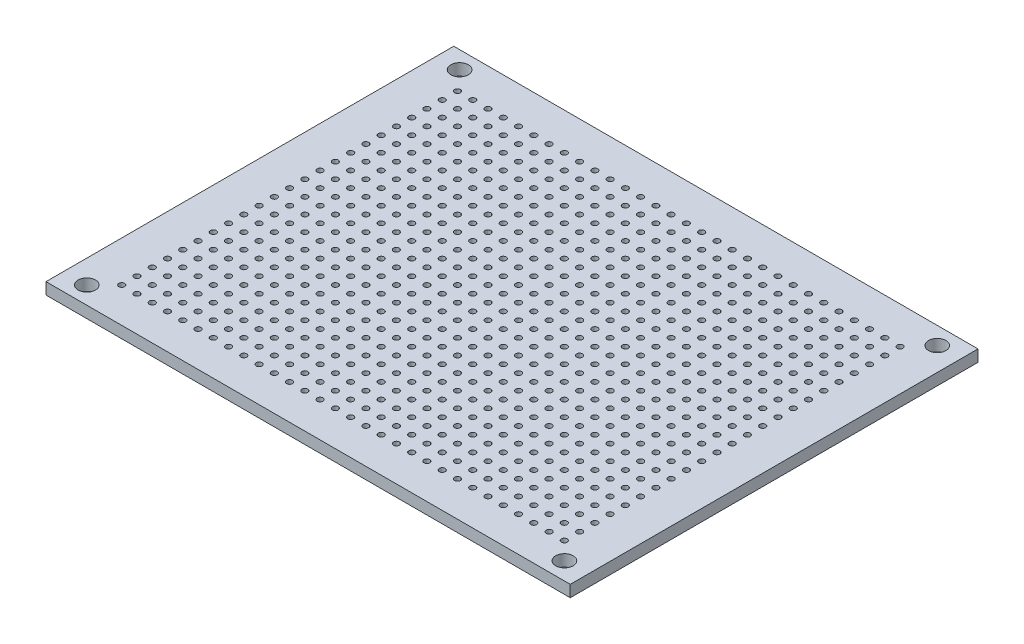
from build123d import *

# Parameters (mm, degrees)
SKETCH1_W           = 90
SKETCH1_H           = 70
SKETCH1_R           = 1.5
SKETCH1_R_2         = 0.5
BOSS_EXTRUDE1_DEPTH = 2


with BuildPart() as part:
    # Sketch1 → Boss-Extrude1 (new body)
    with BuildSketch(Plane(origin=(0, 0, 0), x_dir=(1, 0, 0), z_dir=(0, 1, 0))):
        Rectangle(SKETCH1_W, SKETCH1_H)
        with Locations((-41, -32)):
            Circle(SKETCH1_R, mode=Mode.SUBTRACT)
        with Locations((-38, -29)):
            Circle(SKETCH1_R_2, mode=Mode.SUBTRACT)
        with Locations((-35.38, -29)):
            Circle(SKETCH1_R_2, mode=Mode.SUBTRACT)
        with Locations((-32.76, -29)):
            Circle(SKETCH1_R_2, mode=Mode.SUBTRACT)
        with Locations((-30.14, -29)):
            Circle(SKETCH1_R_2, mode=Mode.SUBTRACT)
        with Locations((-27.52, -29)):
            Circle(SKETCH1_R_2, mode=Mode.SUBTRACT)
        with Locations((-24.9, -29)):
            Circle(SKETCH1_R_2, mode=Mode.SUBTRACT)
        with Locations((-22.28, -29)):
            Circle(SKETCH1_R_2, mode=Mode.SUBTRACT)
        with Locations((-19.66, -29)):
            Circle(SKETCH1_R_2, mode=Mode.SUBTRACT)
        with Locations((-17.04, -29)):
            Circle(SKETCH1_R_2, mode=Mode.SUBTRACT)
        with Locations((-14.42, -29)):
            Circle(SKETCH1_R_2, mode=Mode.SUBTRACT)
        with Locations((-11.8, -29)):
            Circle(SKETCH1_R_2, mode=Mode.SUBTRACT)
        with Locations((-9.18, -29)):
            Circle(SKETCH1_R_2, mode=Mode.SUBTRACT)
        with Locations((-6.56, -29)):
            Circle(SKETCH1_R_2, mode=Mode.SUBTRACT)
        with Locations((-3.94, -29)):
            Circle(SKETCH1_R_2, mode=Mode.SUBTRACT)
        with Locations((-1.32, -29)):
            Circle(SKETCH1_R_2, mode=Mode.SUBTRACT)
        with Locations((1.3, -29)):
            Circle(SKETCH1_R_2, mode=Mode.SUBTRACT)
        with Locations((3.92, -29)):
            Circle(SKETCH1_R_2, mode=Mode.SUBTRACT)
        with Locations((6.54, -29)):
            Circle(SKETCH1_R_2, mode=Mode.SUBTRACT)
        with Locations((9.16, -29)):
            Circle(SKETCH1_R_2, mode=Mode.SUBTRACT)
        with Locations((11.78, -29)):
            Circle(SKETCH1_R_2, mode=Mode.SUBTRACT)
        with Locations((14.4, -29)):
            Circle(SKETCH1_R_2, mode=Mode.SUBTRACT)
        with Locations((17.02, -29)):
            Circle(SKETCH1_R_2, mode=Mode.SUBTRACT)
        with Locations((19.64, -29)):
            Circle(SKETCH1_R_2, mode=Mode.SUBTRACT)
        with Locations((22.26, -29)):
            Circle(SKETCH1_R_2, mode=Mode.SUBTRACT)
        with Locations((24.88, -29)):
            Circle(SKETCH1_R_2, mode=Mode.SUBTRACT)
        with Locations((27.5, -29)):
            Circle(SKETCH1_R_2, mode=Mode.SUBTRACT)
        with Locations((30.12, -29)):
            Circle(SKETCH1_R_2, mode=Mode.SUBTRACT)
        with Locations((32.74, -29)):
            Circle(SKETCH1_R_2, mode=Mode.SUBTRACT)
        with Locations((35.36, -29)):
            Circle(SKETCH1_R_2, mode=Mode.SUBTRACT)
        with Locations((37.98, -29)):
            Circle(SKETCH1_R_2, mode=Mode.SUBTRACT)
        with Locations((-38, -26.38)):
            Circle(SKETCH1_R_2, mode=Mode.SUBTRACT)
        with Locations((-35.38, -26.38)):
            Circle(SKETCH1_R_2, mode=Mode.SUBTRACT)
        with Locations((-32.76, -26.38)):
            Circle(SKETCH1_R_2, mode=Mode.SUBTRACT)
        with Locations((-30.14, -26.38)):
            Circle(SKETCH1_R_2, mode=Mode.SUBTRACT)
        with Locations((-27.52, -26.38)):
            Circle(SKETCH1_R_2, mode=Mode.SUBTRACT)
        with Locations((-24.9, -26.38)):
            Circle(SKETCH1_R_2, mode=Mode.SUBTRACT)
        with Locations((-22.28, -26.38)):
            Circle(SKETCH1_R_2, mode=Mode.SUBTRACT)
        with Locations((-19.66, -26.38)):
            Circle(SKETCH1_R_2, mode=Mode.SUBTRACT)
        with Locations((-17.04, -26.38)):
            Circle(SKETCH1_R_2, mode=Mode.SUBTRACT)
        with Locations((-14.42, -26.38)):
            Circle(SKETCH1_R_2, mode=Mode.SUBTRACT)
        with Locations((-11.8, -26.38)):
            Circle(SKETCH1_R_2, mode=Mode.SUBTRACT)
        with Locations((-9.18, -26.38)):
            Circle(SKETCH1_R_2, mode=Mode.SUBTRACT)
        with Locations((-6.56, -26.38)):
            Circle(SKETCH1_R_2, mode=Mode.SUBTRACT)
        with Locations((-3.94, -26.38)):
            Circle(SKETCH1_R_2, mode=Mode.SUBTRACT)
        with Locations((-1.32, -26.38)):
            Circle(SKETCH1_R_2, mode=Mode.SUBTRACT)
        with Locations((1.3, -26.38)):
            Circle(SKETCH1_R_2, mode=Mode.SUBTRACT)
        with Locations((3.92, -26.38)):
            Circle(SKETCH1_R_2, mode=Mode.SUBTRACT)
        with Locations((6.54, -26.38)):
            Circle(SKETCH1_R_2, mode=Mode.SUBTRACT)
        with Locations((9.16, -26.38)):
            Circle(SKETCH1_R_2, mode=Mode.SUBTRACT)
        with Locations((11.78, -26.38)):
            Circle(SKETCH1_R_2, mode=Mode.SUBTRACT)
        with Locations((14.4, -26.38)):
            Circle(SKETCH1_R_2, mode=Mode.SUBTRACT)
        with Locations((17.02, -26.38)):
            Circle(SKETCH1_R_2, mode=Mode.SUBTRACT)
        with Locations((19.64, -26.38)):
            Circle(SKETCH1_R_2, mode=Mode.SUBTRACT)
        with Locations((22.26, -26.38)):
            Circle(SKETCH1_R_2, mode=Mode.SUBTRACT)
        with Locations((24.88, -26.38)):
            Circle(SKETCH1_R_2, mode=Mode.SUBTRACT)
        with Locations((27.5, -26.38)):
            Circle(SKETCH1_R_2, mode=Mode.SUBTRACT)
        with Locations((30.12, -26.38)):
            Circle(SKETCH1_R_2, mode=Mode.SUBTRACT)
        with Locations((32.74, -26.38)):
            Circle(SKETCH1_R_2, mode=Mode.SUBTRACT)
        with Locations((35.36, -26.38)):
            Circle(SKETCH1_R_2, mode=Mode.SUBTRACT)
        with Locations((37.98, -26.38)):
            Circle(SKETCH1_R_2, mode=Mode.SUBTRACT)
        with Locations((-38, -23.76)):
            Circle(SKETCH1_R_2, mode=Mode.SUBTRACT)
        with Locations((-35.38, -23.76)):
            Circle(SKETCH1_R_2, mode=Mode.SUBTRACT)
        with Locations((-32.76, -23.76)):
            Circle(SKETCH1_R_2, mode=Mode.SUBTRACT)
        with Locations((-30.14, -23.76)):
            Circle(SKETCH1_R_2, mode=Mode.SUBTRACT)
        with Locations((-27.52, -23.76)):
            Circle(SKETCH1_R_2, mode=Mode.SUBTRACT)
        with Locations((-24.9, -23.76)):
            Circle(SKETCH1_R_2, mode=Mode.SUBTRACT)
        with Locations((-22.28, -23.76)):
            Circle(SKETCH1_R_2, mode=Mode.SUBTRACT)
        with Locations((-19.66, -23.76)):
            Circle(SKETCH1_R_2, mode=Mode.SUBTRACT)
        with Locations((-17.04, -23.76)):
            Circle(SKETCH1_R_2, mode=Mode.SUBTRACT)
        with Locations((-14.42, -23.76)):
            Circle(SKETCH1_R_2, mode=Mode.SUBTRACT)
        with Locations((-11.8, -23.76)):
            Circle(SKETCH1_R_2, mode=Mode.SUBTRACT)
        with Locations((-9.18, -23.76)):
            Circle(SKETCH1_R_2, mode=Mode.SUBTRACT)
        with Locations((-6.56, -23.76)):
            Circle(SKETCH1_R_2, mode=Mode.SUBTRACT)
        with Locations((-3.94, -23.76)):
            Circle(SKETCH1_R_2, mode=Mode.SUBTRACT)
        with Locations((-1.32, -23.76)):
            Circle(SKETCH1_R_2, mode=Mode.SUBTRACT)
        with Locations((1.3, -23.76)):
            Circle(SKETCH1_R_2, mode=Mode.SUBTRACT)
        with Locations((3.92, -23.76)):
            Circle(SKETCH1_R_2, mode=Mode.SUBTRACT)
        with Locations((6.54, -23.76)):
            Circle(SKETCH1_R_2, mode=Mode.SUBTRACT)
        with Locations((9.16, -23.76)):
            Circle(SKETCH1_R_2, mode=Mode.SUBTRACT)
        with Locations((11.78, -23.76)):
            Circle(SKETCH1_R_2, mode=Mode.SUBTRACT)
        with Locations((14.4, -23.76)):
            Circle(SKETCH1_R_2, mode=Mode.SUBTRACT)
        with Locations((17.02, -23.76)):
            Circle(SKETCH1_R_2, mode=Mode.SUBTRACT)
        with Locations((19.64, -23.76)):
            Circle(SKETCH1_R_2, mode=Mode.SUBTRACT)
        with Locations((22.26, -23.76)):
            Circle(SKETCH1_R_2, mode=Mode.SUBTRACT)
        with Locations((24.88, -23.76)):
            Circle(SKETCH1_R_2, mode=Mode.SUBTRACT)
        with Locations((27.5, -23.76)):
            Circle(SKETCH1_R_2, mode=Mode.SUBTRACT)
        with Locations((30.12, -23.76)):
            Circle(SKETCH1_R_2, mode=Mode.SUBTRACT)
        with Locations((32.74, -23.76)):
            Circle(SKETCH1_R_2, mode=Mode.SUBTRACT)
        with Locations((35.36, -23.76)):
            Circle(SKETCH1_R_2, mode=Mode.SUBTRACT)
        with Locations((37.98, -23.76)):
            Circle(SKETCH1_R_2, mode=Mode.SUBTRACT)
        with Locations((-38, -21.14)):
            Circle(SKETCH1_R_2, mode=Mode.SUBTRACT)
        with Locations((-35.38, -21.14)):
            Circle(SKETCH1_R_2, mode=Mode.SUBTRACT)
        with Locations((-32.76, -21.14)):
            Circle(SKETCH1_R_2, mode=Mode.SUBTRACT)
        with Locations((-30.14, -21.14)):
            Circle(SKETCH1_R_2, mode=Mode.SUBTRACT)
        with Locations((-27.52, -21.14)):
            Circle(SKETCH1_R_2, mode=Mode.SUBTRACT)
        with Locations((-24.9, -21.14)):
            Circle(SKETCH1_R_2, mode=Mode.SUBTRACT)
        with Locations((-22.28, -21.14)):
            Circle(SKETCH1_R_2, mode=Mode.SUBTRACT)
        with Locations((-19.66, -21.14)):
            Circle(SKETCH1_R_2, mode=Mode.SUBTRACT)
        with Locations((-17.04, -21.14)):
            Circle(SKETCH1_R_2, mode=Mode.SUBTRACT)
        with Locations((-14.42, -21.14)):
            Circle(SKETCH1_R_2, mode=Mode.SUBTRACT)
        with Locations((-11.8, -21.14)):
            Circle(SKETCH1_R_2, mode=Mode.SUBTRACT)
        with Locations((-9.18, -21.14)):
            Circle(SKETCH1_R_2, mode=Mode.SUBTRACT)
        with Locations((-6.56, -21.14)):
            Circle(SKETCH1_R_2, mode=Mode.SUBTRACT)
        with Locations((-3.94, -21.14)):
            Circle(SKETCH1_R_2, mode=Mode.SUBTRACT)
        with Locations((-1.32, -21.14)):
            Circle(SKETCH1_R_2, mode=Mode.SUBTRACT)
        with Locations((1.3, -21.14)):
            Circle(SKETCH1_R_2, mode=Mode.SUBTRACT)
        with Locations((3.92, -21.14)):
            Circle(SKETCH1_R_2, mode=Mode.SUBTRACT)
        with Locations((6.54, -21.14)):
            Circle(SKETCH1_R_2, mode=Mode.SUBTRACT)
        with Locations((9.16, -21.14)):
            Circle(SKETCH1_R_2, mode=Mode.SUBTRACT)
        with Locations((11.78, -21.14)):
            Circle(SKETCH1_R_2, mode=Mode.SUBTRACT)
        with Locations((14.4, -21.14)):
            Circle(SKETCH1_R_2, mode=Mode.SUBTRACT)
        with Locations((17.02, -21.14)):
            Circle(SKETCH1_R_2, mode=Mode.SUBTRACT)
        with Locations((19.64, -21.14)):
            Circle(SKETCH1_R_2, mode=Mode.SUBTRACT)
        with Locations((22.26, -21.14)):
            Circle(SKETCH1_R_2, mode=Mode.SUBTRACT)
        with Locations((24.88, -21.14)):
            Circle(SKETCH1_R_2, mode=Mode.SUBTRACT)
        with Locations((27.5, -21.14)):
            Circle(SKETCH1_R_2, mode=Mode.SUBTRACT)
        with Locations((30.12, -21.14)):
            Circle(SKETCH1_R_2, mode=Mode.SUBTRACT)
        with Locations((32.74, -21.14)):
            Circle(SKETCH1_R_2, mode=Mode.SUBTRACT)
        with Locations((35.36, -21.14)):
            Circle(SKETCH1_R_2, mode=Mode.SUBTRACT)
        with Locations((37.98, -21.14)):
            Circle(SKETCH1_R_2, mode=Mode.SUBTRACT)
        with Locations((-38, -18.52)):
            Circle(SKETCH1_R_2, mode=Mode.SUBTRACT)
        with Locations((-35.38, -18.52)):
            Circle(SKETCH1_R_2, mode=Mode.SUBTRACT)
        with Locations((-32.76, -18.52)):
            Circle(SKETCH1_R_2, mode=Mode.SUBTRACT)
        with Locations((-30.14, -18.52)):
            Circle(SKETCH1_R_2, mode=Mode.SUBTRACT)
        with Locations((-27.52, -18.52)):
            Circle(SKETCH1_R_2, mode=Mode.SUBTRACT)
        with Locations((-24.9, -18.52)):
            Circle(SKETCH1_R_2, mode=Mode.SUBTRACT)
        with Locations((-22.28, -18.52)):
            Circle(SKETCH1_R_2, mode=Mode.SUBTRACT)
        with Locations((-19.66, -18.52)):
            Circle(SKETCH1_R_2, mode=Mode.SUBTRACT)
        with Locations((-17.04, -18.52)):
            Circle(SKETCH1_R_2, mode=Mode.SUBTRACT)
        with Locations((-14.42, -18.52)):
            Circle(SKETCH1_R_2, mode=Mode.SUBTRACT)
        with Locations((-11.8, -18.52)):
            Circle(SKETCH1_R_2, mode=Mode.SUBTRACT)
        with Locations((-9.18, -18.52)):
            Circle(SKETCH1_R_2, mode=Mode.SUBTRACT)
        with Locations((-6.56, -18.52)):
            Circle(SKETCH1_R_2, mode=Mode.SUBTRACT)
        with Locations((-3.94, -18.52)):
            Circle(SKETCH1_R_2, mode=Mode.SUBTRACT)
        with Locations((-1.32, -18.52)):
            Circle(SKETCH1_R_2, mode=Mode.SUBTRACT)
        with Locations((1.3, -18.52)):
            Circle(SKETCH1_R_2, mode=Mode.SUBTRACT)
        with Locations((3.92, -18.52)):
            Circle(SKETCH1_R_2, mode=Mode.SUBTRACT)
        with Locations((6.54, -18.52)):
            Circle(SKETCH1_R_2, mode=Mode.SUBTRACT)
        with Locations((9.16, -18.52)):
            Circle(SKETCH1_R_2, mode=Mode.SUBTRACT)
        with Locations((11.78, -18.52)):
            Circle(SKETCH1_R_2, mode=Mode.SUBTRACT)
        with Locations((14.4, -18.52)):
            Circle(SKETCH1_R_2, mode=Mode.SUBTRACT)
        with Locations((17.02, -18.52)):
            Circle(SKETCH1_R_2, mode=Mode.SUBTRACT)
        with Locations((19.64, -18.52)):
            Circle(SKETCH1_R_2, mode=Mode.SUBTRACT)
        with Locations((22.26, -18.52)):
            Circle(SKETCH1_R_2, mode=Mode.SUBTRACT)
        with Locations((24.88, -18.52)):
            Circle(SKETCH1_R_2, mode=Mode.SUBTRACT)
        with Locations((27.5, -18.52)):
            Circle(SKETCH1_R_2, mode=Mode.SUBTRACT)
        with Locations((30.12, -18.52)):
            Circle(SKETCH1_R_2, mode=Mode.SUBTRACT)
        with Locations((32.74, -18.52)):
            Circle(SKETCH1_R_2, mode=Mode.SUBTRACT)
        with Locations((35.36, -18.52)):
            Circle(SKETCH1_R_2, mode=Mode.SUBTRACT)
        with Locations((37.98, -18.52)):
            Circle(SKETCH1_R_2, mode=Mode.SUBTRACT)
        with Locations((-38, -15.9)):
            Circle(SKETCH1_R_2, mode=Mode.SUBTRACT)
        with Locations((-35.38, -15.9)):
            Circle(SKETCH1_R_2, mode=Mode.SUBTRACT)
        with Locations((-32.76, -15.9)):
            Circle(SKETCH1_R_2, mode=Mode.SUBTRACT)
        with Locations((-30.14, -15.9)):
            Circle(SKETCH1_R_2, mode=Mode.SUBTRACT)
        with Locations((-27.52, -15.9)):
            Circle(SKETCH1_R_2, mode=Mode.SUBTRACT)
        with Locations((-24.9, -15.9)):
            Circle(SKETCH1_R_2, mode=Mode.SUBTRACT)
        with Locations((-22.28, -15.9)):
            Circle(SKETCH1_R_2, mode=Mode.SUBTRACT)
        with Locations((-19.66, -15.9)):
            Circle(SKETCH1_R_2, mode=Mode.SUBTRACT)
        with Locations((-17.04, -15.9)):
            Circle(SKETCH1_R_2, mode=Mode.SUBTRACT)
        with Locations((-14.42, -15.9)):
            Circle(SKETCH1_R_2, mode=Mode.SUBTRACT)
        with Locations((-11.8, -15.9)):
            Circle(SKETCH1_R_2, mode=Mode.SUBTRACT)
        with Locations((-9.18, -15.9)):
            Circle(SKETCH1_R_2, mode=Mode.SUBTRACT)
        with Locations((-6.56, -15.9)):
            Circle(SKETCH1_R_2, mode=Mode.SUBTRACT)
        with Locations((-3.94, -15.9)):
            Circle(SKETCH1_R_2, mode=Mode.SUBTRACT)
        with Locations((-1.32, -15.9)):
            Circle(SKETCH1_R_2, mode=Mode.SUBTRACT)
        with Locations((1.3, -15.9)):
            Circle(SKETCH1_R_2, mode=Mode.SUBTRACT)
        with Locations((3.92, -15.9)):
            Circle(SKETCH1_R_2, mode=Mode.SUBTRACT)
        with Locations((6.54, -15.9)):
            Circle(SKETCH1_R_2, mode=Mode.SUBTRACT)
        with Locations((9.16, -15.9)):
            Circle(SKETCH1_R_2, mode=Mode.SUBTRACT)
        with Locations((11.78, -15.9)):
            Circle(SKETCH1_R_2, mode=Mode.SUBTRACT)
        with Locations((14.4, -15.9)):
            Circle(SKETCH1_R_2, mode=Mode.SUBTRACT)
        with Locations((17.02, -15.9)):
            Circle(SKETCH1_R_2, mode=Mode.SUBTRACT)
        with Locations((19.64, -15.9)):
            Circle(SKETCH1_R_2, mode=Mode.SUBTRACT)
        with Locations((22.26, -15.9)):
            Circle(SKETCH1_R_2, mode=Mode.SUBTRACT)
        with Locations((24.88, -15.9)):
            Circle(SKETCH1_R_2, mode=Mode.SUBTRACT)
        with Locations((27.5, -15.9)):
            Circle(SKETCH1_R_2, mode=Mode.SUBTRACT)
        with Locations((30.12, -15.9)):
            Circle(SKETCH1_R_2, mode=Mode.SUBTRACT)
        with Locations((32.74, -15.9)):
            Circle(SKETCH1_R_2, mode=Mode.SUBTRACT)
        with Locations((35.36, -15.9)):
            Circle(SKETCH1_R_2, mode=Mode.SUBTRACT)
        with Locations((37.98, -15.9)):
            Circle(SKETCH1_R_2, mode=Mode.SUBTRACT)
        with Locations((-38, -13.28)):
            Circle(SKETCH1_R_2, mode=Mode.SUBTRACT)
        with Locations((-35.38, -13.28)):
            Circle(SKETCH1_R_2, mode=Mode.SUBTRACT)
        with Locations((-32.76, -13.28)):
            Circle(SKETCH1_R_2, mode=Mode.SUBTRACT)
        with Locations((-30.14, -13.28)):
            Circle(SKETCH1_R_2, mode=Mode.SUBTRACT)
        with Locations((-27.52, -13.28)):
            Circle(SKETCH1_R_2, mode=Mode.SUBTRACT)
        with Locations((-24.9, -13.28)):
            Circle(SKETCH1_R_2, mode=Mode.SUBTRACT)
        with Locations((-22.28, -13.28)):
            Circle(SKETCH1_R_2, mode=Mode.SUBTRACT)
        with Locations((-19.66, -13.28)):
            Circle(SKETCH1_R_2, mode=Mode.SUBTRACT)
        with Locations((-17.04, -13.28)):
            Circle(SKETCH1_R_2, mode=Mode.SUBTRACT)
        with Locations((-14.42, -13.28)):
            Circle(SKETCH1_R_2, mode=Mode.SUBTRACT)
        with Locations((-11.8, -13.28)):
            Circle(SKETCH1_R_2, mode=Mode.SUBTRACT)
        with Locations((-9.18, -13.28)):
            Circle(SKETCH1_R_2, mode=Mode.SUBTRACT)
        with Locations((-6.56, -13.28)):
            Circle(SKETCH1_R_2, mode=Mode.SUBTRACT)
        with Locations((-3.94, -13.28)):
            Circle(SKETCH1_R_2, mode=Mode.SUBTRACT)
        with Locations((-1.32, -13.28)):
            Circle(SKETCH1_R_2, mode=Mode.SUBTRACT)
        with Locations((1.3, -13.28)):
            Circle(SKETCH1_R_2, mode=Mode.SUBTRACT)
        with Locations((3.92, -13.28)):
            Circle(SKETCH1_R_2, mode=Mode.SUBTRACT)
        with Locations((6.54, -13.28)):
            Circle(SKETCH1_R_2, mode=Mode.SUBTRACT)
        with Locations((9.16, -13.28)):
            Circle(SKETCH1_R_2, mode=Mode.SUBTRACT)
        with Locations((11.78, -13.28)):
            Circle(SKETCH1_R_2, mode=Mode.SUBTRACT)
        with Locations((14.4, -13.28)):
            Circle(SKETCH1_R_2, mode=Mode.SUBTRACT)
        with Locations((17.02, -13.28)):
            Circle(SKETCH1_R_2, mode=Mode.SUBTRACT)
        with Locations((19.64, -13.28)):
            Circle(SKETCH1_R_2, mode=Mode.SUBTRACT)
        with Locations((22.26, -13.28)):
            Circle(SKETCH1_R_2, mode=Mode.SUBTRACT)
        with Locations((24.88, -13.28)):
            Circle(SKETCH1_R_2, mode=Mode.SUBTRACT)
        with Locations((27.5, -13.28)):
            Circle(SKETCH1_R_2, mode=Mode.SUBTRACT)
        with Locations((30.12, -13.28)):
            Circle(SKETCH1_R_2, mode=Mode.SUBTRACT)
        with Locations((32.74, -13.28)):
            Circle(SKETCH1_R_2, mode=Mode.SUBTRACT)
        with Locations((35.36, -13.28)):
            Circle(SKETCH1_R_2, mode=Mode.SUBTRACT)
        with Locations((37.98, -13.28)):
            Circle(SKETCH1_R_2, mode=Mode.SUBTRACT)
        with Locations((-38, -10.66)):
            Circle(SKETCH1_R_2, mode=Mode.SUBTRACT)
        with Locations((-35.38, -10.66)):
            Circle(SKETCH1_R_2, mode=Mode.SUBTRACT)
        with Locations((-32.76, -10.66)):
            Circle(SKETCH1_R_2, mode=Mode.SUBTRACT)
        with Locations((-30.14, -10.66)):
            Circle(SKETCH1_R_2, mode=Mode.SUBTRACT)
        with Locations((-27.52, -10.66)):
            Circle(SKETCH1_R_2, mode=Mode.SUBTRACT)
        with Locations((-24.9, -10.66)):
            Circle(SKETCH1_R_2, mode=Mode.SUBTRACT)
        with Locations((-22.28, -10.66)):
            Circle(SKETCH1_R_2, mode=Mode.SUBTRACT)
        with Locations((-19.66, -10.66)):
            Circle(SKETCH1_R_2, mode=Mode.SUBTRACT)
        with Locations((-17.04, -10.66)):
            Circle(SKETCH1_R_2, mode=Mode.SUBTRACT)
        with Locations((-14.42, -10.66)):
            Circle(SKETCH1_R_2, mode=Mode.SUBTRACT)
        with Locations((-11.8, -10.66)):
            Circle(SKETCH1_R_2, mode=Mode.SUBTRACT)
        with Locations((-9.18, -10.66)):
            Circle(SKETCH1_R_2, mode=Mode.SUBTRACT)
        with Locations((-6.56, -10.66)):
            Circle(SKETCH1_R_2, mode=Mode.SUBTRACT)
        with Locations((-3.94, -10.66)):
            Circle(SKETCH1_R_2, mode=Mode.SUBTRACT)
        with Locations((-1.32, -10.66)):
            Circle(SKETCH1_R_2, mode=Mode.SUBTRACT)
        with Locations((1.3, -10.66)):
            Circle(SKETCH1_R_2, mode=Mode.SUBTRACT)
        with Locations((3.92, -10.66)):
            Circle(SKETCH1_R_2, mode=Mode.SUBTRACT)
        with Locations((6.54, -10.66)):
            Circle(SKETCH1_R_2, mode=Mode.SUBTRACT)
        with Locations((9.16, -10.66)):
            Circle(SKETCH1_R_2, mode=Mode.SUBTRACT)
        with Locations((11.78, -10.66)):
            Circle(SKETCH1_R_2, mode=Mode.SUBTRACT)
        with Locations((14.4, -10.66)):
            Circle(SKETCH1_R_2, mode=Mode.SUBTRACT)
        with Locations((17.02, -10.66)):
            Circle(SKETCH1_R_2, mode=Mode.SUBTRACT)
        with Locations((19.64, -10.66)):
            Circle(SKETCH1_R_2, mode=Mode.SUBTRACT)
        with Locations((22.26, -10.66)):
            Circle(SKETCH1_R_2, mode=Mode.SUBTRACT)
        with Locations((24.88, -10.66)):
            Circle(SKETCH1_R_2, mode=Mode.SUBTRACT)
        with Locations((27.5, -10.66)):
            Circle(SKETCH1_R_2, mode=Mode.SUBTRACT)
        with Locations((30.12, -10.66)):
            Circle(SKETCH1_R_2, mode=Mode.SUBTRACT)
        with Locations((32.74, -10.66)):
            Circle(SKETCH1_R_2, mode=Mode.SUBTRACT)
        with Locations((35.36, -10.66)):
            Circle(SKETCH1_R_2, mode=Mode.SUBTRACT)
        with Locations((37.98, -10.66)):
            Circle(SKETCH1_R_2, mode=Mode.SUBTRACT)
        with Locations((-38, -8.04)):
            Circle(SKETCH1_R_2, mode=Mode.SUBTRACT)
        with Locations((-35.38, -8.04)):
            Circle(SKETCH1_R_2, mode=Mode.SUBTRACT)
        with Locations((-32.76, -8.04)):
            Circle(SKETCH1_R_2, mode=Mode.SUBTRACT)
        with Locations((-30.14, -8.04)):
            Circle(SKETCH1_R_2, mode=Mode.SUBTRACT)
        with Locations((-27.52, -8.04)):
            Circle(SKETCH1_R_2, mode=Mode.SUBTRACT)
        with Locations((-24.9, -8.04)):
            Circle(SKETCH1_R_2, mode=Mode.SUBTRACT)
        with Locations((-22.28, -8.04)):
            Circle(SKETCH1_R_2, mode=Mode.SUBTRACT)
        with Locations((-19.66, -8.04)):
            Circle(SKETCH1_R_2, mode=Mode.SUBTRACT)
        with Locations((-17.04, -8.04)):
            Circle(SKETCH1_R_2, mode=Mode.SUBTRACT)
        with Locations((-14.42, -8.04)):
            Circle(SKETCH1_R_2, mode=Mode.SUBTRACT)
        with Locations((-11.8, -8.04)):
            Circle(SKETCH1_R_2, mode=Mode.SUBTRACT)
        with Locations((-9.18, -8.04)):
            Circle(SKETCH1_R_2, mode=Mode.SUBTRACT)
        with Locations((-6.56, -8.04)):
            Circle(SKETCH1_R_2, mode=Mode.SUBTRACT)
        with Locations((-3.94, -8.04)):
            Circle(SKETCH1_R_2, mode=Mode.SUBTRACT)
        with Locations((-1.32, -8.04)):
            Circle(SKETCH1_R_2, mode=Mode.SUBTRACT)
        with Locations((1.3, -8.04)):
            Circle(SKETCH1_R_2, mode=Mode.SUBTRACT)
        with Locations((3.92, -8.04)):
            Circle(SKETCH1_R_2, mode=Mode.SUBTRACT)
        with Locations((6.54, -8.04)):
            Circle(SKETCH1_R_2, mode=Mode.SUBTRACT)
        with Locations((9.16, -8.04)):
            Circle(SKETCH1_R_2, mode=Mode.SUBTRACT)
        with Locations((11.78, -8.04)):
            Circle(SKETCH1_R_2, mode=Mode.SUBTRACT)
        with Locations((14.4, -8.04)):
            Circle(SKETCH1_R_2, mode=Mode.SUBTRACT)
        with Locations((17.02, -8.04)):
            Circle(SKETCH1_R_2, mode=Mode.SUBTRACT)
        with Locations((19.64, -8.04)):
            Circle(SKETCH1_R_2, mode=Mode.SUBTRACT)
        with Locations((22.26, -8.04)):
            Circle(SKETCH1_R_2, mode=Mode.SUBTRACT)
        with Locations((24.88, -8.04)):
            Circle(SKETCH1_R_2, mode=Mode.SUBTRACT)
        with Locations((27.5, -8.04)):
            Circle(SKETCH1_R_2, mode=Mode.SUBTRACT)
        with Locations((30.12, -8.04)):
            Circle(SKETCH1_R_2, mode=Mode.SUBTRACT)
        with Locations((32.74, -8.04)):
            Circle(SKETCH1_R_2, mode=Mode.SUBTRACT)
        with Locations((35.36, -8.04)):
            Circle(SKETCH1_R_2, mode=Mode.SUBTRACT)
        with Locations((37.98, -8.04)):
            Circle(SKETCH1_R_2, mode=Mode.SUBTRACT)
        with Locations((-38, -5.42)):
            Circle(SKETCH1_R_2, mode=Mode.SUBTRACT)
        with Locations((-35.38, -5.42)):
            Circle(SKETCH1_R_2, mode=Mode.SUBTRACT)
        with Locations((-32.76, -5.42)):
            Circle(SKETCH1_R_2, mode=Mode.SUBTRACT)
        with Locations((-30.14, -5.42)):
            Circle(SKETCH1_R_2, mode=Mode.SUBTRACT)
        with Locations((-27.52, -5.42)):
            Circle(SKETCH1_R_2, mode=Mode.SUBTRACT)
        with Locations((-24.9, -5.42)):
            Circle(SKETCH1_R_2, mode=Mode.SUBTRACT)
        with Locations((-22.28, -5.42)):
            Circle(SKETCH1_R_2, mode=Mode.SUBTRACT)
        with Locations((-19.66, -5.42)):
            Circle(SKETCH1_R_2, mode=Mode.SUBTRACT)
        with Locations((-17.04, -5.42)):
            Circle(SKETCH1_R_2, mode=Mode.SUBTRACT)
        with Locations((-14.42, -5.42)):
            Circle(SKETCH1_R_2, mode=Mode.SUBTRACT)
        with Locations((-11.8, -5.42)):
            Circle(SKETCH1_R_2, mode=Mode.SUBTRACT)
        with Locations((-9.18, -5.42)):
            Circle(SKETCH1_R_2, mode=Mode.SUBTRACT)
        with Locations((-6.56, -5.42)):
            Circle(SKETCH1_R_2, mode=Mode.SUBTRACT)
        with Locations((-3.94, -5.42)):
            Circle(SKETCH1_R_2, mode=Mode.SUBTRACT)
        with Locations((-1.32, -5.42)):
            Circle(SKETCH1_R_2, mode=Mode.SUBTRACT)
        with Locations((1.3, -5.42)):
            Circle(SKETCH1_R_2, mode=Mode.SUBTRACT)
        with Locations((3.92, -5.42)):
            Circle(SKETCH1_R_2, mode=Mode.SUBTRACT)
        with Locations((6.54, -5.42)):
            Circle(SKETCH1_R_2, mode=Mode.SUBTRACT)
        with Locations((9.16, -5.42)):
            Circle(SKETCH1_R_2, mode=Mode.SUBTRACT)
        with Locations((11.78, -5.42)):
            Circle(SKETCH1_R_2, mode=Mode.SUBTRACT)
        with Locations((14.4, -5.42)):
            Circle(SKETCH1_R_2, mode=Mode.SUBTRACT)
        with Locations((17.02, -5.42)):
            Circle(SKETCH1_R_2, mode=Mode.SUBTRACT)
        with Locations((19.64, -5.42)):
            Circle(SKETCH1_R_2, mode=Mode.SUBTRACT)
        with Locations((22.26, -5.42)):
            Circle(SKETCH1_R_2, mode=Mode.SUBTRACT)
        with Locations((24.88, -5.42)):
            Circle(SKETCH1_R_2, mode=Mode.SUBTRACT)
        with Locations((27.5, -5.42)):
            Circle(SKETCH1_R_2, mode=Mode.SUBTRACT)
        with Locations((30.12, -5.42)):
            Circle(SKETCH1_R_2, mode=Mode.SUBTRACT)
        with Locations((32.74, -5.42)):
            Circle(SKETCH1_R_2, mode=Mode.SUBTRACT)
        with Locations((35.36, -5.42)):
            Circle(SKETCH1_R_2, mode=Mode.SUBTRACT)
        with Locations((37.98, -5.42)):
            Circle(SKETCH1_R_2, mode=Mode.SUBTRACT)
        with Locations((-38, -2.8)):
            Circle(SKETCH1_R_2, mode=Mode.SUBTRACT)
        with Locations((-35.38, -2.8)):
            Circle(SKETCH1_R_2, mode=Mode.SUBTRACT)
        with Locations((-32.76, -2.8)):
            Circle(SKETCH1_R_2, mode=Mode.SUBTRACT)
        with Locations((-30.14, -2.8)):
            Circle(SKETCH1_R_2, mode=Mode.SUBTRACT)
        with Locations((-27.52, -2.8)):
            Circle(SKETCH1_R_2, mode=Mode.SUBTRACT)
        with Locations((-24.9, -2.8)):
            Circle(SKETCH1_R_2, mode=Mode.SUBTRACT)
        with Locations((-22.28, -2.8)):
            Circle(SKETCH1_R_2, mode=Mode.SUBTRACT)
        with Locations((-19.66, -2.8)):
            Circle(SKETCH1_R_2, mode=Mode.SUBTRACT)
        with Locations((-17.04, -2.8)):
            Circle(SKETCH1_R_2, mode=Mode.SUBTRACT)
        with Locations((-14.42, -2.8)):
            Circle(SKETCH1_R_2, mode=Mode.SUBTRACT)
        with Locations((-11.8, -2.8)):
            Circle(SKETCH1_R_2, mode=Mode.SUBTRACT)
        with Locations((-9.18, -2.8)):
            Circle(SKETCH1_R_2, mode=Mode.SUBTRACT)
        with Locations((-6.56, -2.8)):
            Circle(SKETCH1_R_2, mode=Mode.SUBTRACT)
        with Locations((-3.94, -2.8)):
            Circle(SKETCH1_R_2, mode=Mode.SUBTRACT)
        with Locations((-1.32, -2.8)):
            Circle(SKETCH1_R_2, mode=Mode.SUBTRACT)
        with Locations((1.3, -2.8)):
            Circle(SKETCH1_R_2, mode=Mode.SUBTRACT)
        with Locations((3.92, -2.8)):
            Circle(SKETCH1_R_2, mode=Mode.SUBTRACT)
        with Locations((6.54, -2.8)):
            Circle(SKETCH1_R_2, mode=Mode.SUBTRACT)
        with Locations((9.16, -2.8)):
            Circle(SKETCH1_R_2, mode=Mode.SUBTRACT)
        with Locations((11.78, -2.8)):
            Circle(SKETCH1_R_2, mode=Mode.SUBTRACT)
        with Locations((14.4, -2.8)):
            Circle(SKETCH1_R_2, mode=Mode.SUBTRACT)
        with Locations((17.02, -2.8)):
            Circle(SKETCH1_R_2, mode=Mode.SUBTRACT)
        with Locations((19.64, -2.8)):
            Circle(SKETCH1_R_2, mode=Mode.SUBTRACT)
        with Locations((22.26, -2.8)):
            Circle(SKETCH1_R_2, mode=Mode.SUBTRACT)
        with Locations((24.88, -2.8)):
            Circle(SKETCH1_R_2, mode=Mode.SUBTRACT)
        with Locations((27.5, -2.8)):
            Circle(SKETCH1_R_2, mode=Mode.SUBTRACT)
        with Locations((30.12, -2.8)):
            Circle(SKETCH1_R_2, mode=Mode.SUBTRACT)
        with Locations((32.74, -2.8)):
            Circle(SKETCH1_R_2, mode=Mode.SUBTRACT)
        with Locations((35.36, -2.8)):
            Circle(SKETCH1_R_2, mode=Mode.SUBTRACT)
        with Locations((37.98, -2.8)):
            Circle(SKETCH1_R_2, mode=Mode.SUBTRACT)
        with Locations((-38, -0.18)):
            Circle(SKETCH1_R_2, mode=Mode.SUBTRACT)
        with Locations((-35.38, -0.18)):
            Circle(SKETCH1_R_2, mode=Mode.SUBTRACT)
        with Locations((-32.76, -0.18)):
            Circle(SKETCH1_R_2, mode=Mode.SUBTRACT)
        with Locations((-30.14, -0.18)):
            Circle(SKETCH1_R_2, mode=Mode.SUBTRACT)
        with Locations((-27.52, -0.18)):
            Circle(SKETCH1_R_2, mode=Mode.SUBTRACT)
        with Locations((-24.9, -0.18)):
            Circle(SKETCH1_R_2, mode=Mode.SUBTRACT)
        with Locations((-22.28, -0.18)):
            Circle(SKETCH1_R_2, mode=Mode.SUBTRACT)
        with Locations((-19.66, -0.18)):
            Circle(SKETCH1_R_2, mode=Mode.SUBTRACT)
        with Locations((-17.04, -0.18)):
            Circle(SKETCH1_R_2, mode=Mode.SUBTRACT)
        with Locations((-14.42, -0.18)):
            Circle(SKETCH1_R_2, mode=Mode.SUBTRACT)
        with Locations((-11.8, -0.18)):
            Circle(SKETCH1_R_2, mode=Mode.SUBTRACT)
        with Locations((-9.18, -0.18)):
            Circle(SKETCH1_R_2, mode=Mode.SUBTRACT)
        with Locations((-6.56, -0.18)):
            Circle(SKETCH1_R_2, mode=Mode.SUBTRACT)
        with Locations((-3.94, -0.18)):
            Circle(SKETCH1_R_2, mode=Mode.SUBTRACT)
        with Locations((-1.32, -0.18)):
            Circle(SKETCH1_R_2, mode=Mode.SUBTRACT)
        with Locations((1.3, -0.18)):
            Circle(SKETCH1_R_2, mode=Mode.SUBTRACT)
        with Locations((3.92, -0.18)):
            Circle(SKETCH1_R_2, mode=Mode.SUBTRACT)
        with Locations((6.54, -0.18)):
            Circle(SKETCH1_R_2, mode=Mode.SUBTRACT)
        with Locations((9.16, -0.18)):
            Circle(SKETCH1_R_2, mode=Mode.SUBTRACT)
        with Locations((11.78, -0.18)):
            Circle(SKETCH1_R_2, mode=Mode.SUBTRACT)
        with Locations((14.4, -0.18)):
            Circle(SKETCH1_R_2, mode=Mode.SUBTRACT)
        with Locations((17.02, -0.18)):
            Circle(SKETCH1_R_2, mode=Mode.SUBTRACT)
        with Locations((19.64, -0.18)):
            Circle(SKETCH1_R_2, mode=Mode.SUBTRACT)
        with Locations((22.26, -0.18)):
            Circle(SKETCH1_R_2, mode=Mode.SUBTRACT)
        with Locations((24.88, -0.18)):
            Circle(SKETCH1_R_2, mode=Mode.SUBTRACT)
        with Locations((27.5, -0.18)):
            Circle(SKETCH1_R_2, mode=Mode.SUBTRACT)
        with Locations((30.12, -0.18)):
            Circle(SKETCH1_R_2, mode=Mode.SUBTRACT)
        with Locations((32.74, -0.18)):
            Circle(SKETCH1_R_2, mode=Mode.SUBTRACT)
        with Locations((35.36, -0.18)):
            Circle(SKETCH1_R_2, mode=Mode.SUBTRACT)
        with Locations((37.98, -0.18)):
            Circle(SKETCH1_R_2, mode=Mode.SUBTRACT)
        with Locations((-38, 2.44)):
            Circle(SKETCH1_R_2, mode=Mode.SUBTRACT)
        with Locations((-35.38, 2.44)):
            Circle(SKETCH1_R_2, mode=Mode.SUBTRACT)
        with Locations((-32.76, 2.44)):
            Circle(SKETCH1_R_2, mode=Mode.SUBTRACT)
        with Locations((-30.14, 2.44)):
            Circle(SKETCH1_R_2, mode=Mode.SUBTRACT)
        with Locations((-27.52, 2.44)):
            Circle(SKETCH1_R_2, mode=Mode.SUBTRACT)
        with Locations((-24.9, 2.44)):
            Circle(SKETCH1_R_2, mode=Mode.SUBTRACT)
        with Locations((-22.28, 2.44)):
            Circle(SKETCH1_R_2, mode=Mode.SUBTRACT)
        with Locations((-19.66, 2.44)):
            Circle(SKETCH1_R_2, mode=Mode.SUBTRACT)
        with Locations((-17.04, 2.44)):
            Circle(SKETCH1_R_2, mode=Mode.SUBTRACT)
        with Locations((-14.42, 2.44)):
            Circle(SKETCH1_R_2, mode=Mode.SUBTRACT)
        with Locations((-11.8, 2.44)):
            Circle(SKETCH1_R_2, mode=Mode.SUBTRACT)
        with Locations((-9.18, 2.44)):
            Circle(SKETCH1_R_2, mode=Mode.SUBTRACT)
        with Locations((-6.56, 2.44)):
            Circle(SKETCH1_R_2, mode=Mode.SUBTRACT)
        with Locations((-3.94, 2.44)):
            Circle(SKETCH1_R_2, mode=Mode.SUBTRACT)
        with Locations((-1.32, 2.44)):
            Circle(SKETCH1_R_2, mode=Mode.SUBTRACT)
        with Locations((1.3, 2.44)):
            Circle(SKETCH1_R_2, mode=Mode.SUBTRACT)
        with Locations((3.92, 2.44)):
            Circle(SKETCH1_R_2, mode=Mode.SUBTRACT)
        with Locations((6.54, 2.44)):
            Circle(SKETCH1_R_2, mode=Mode.SUBTRACT)
        with Locations((9.16, 2.44)):
            Circle(SKETCH1_R_2, mode=Mode.SUBTRACT)
        with Locations((11.78, 2.44)):
            Circle(SKETCH1_R_2, mode=Mode.SUBTRACT)
        with Locations((14.4, 2.44)):
            Circle(SKETCH1_R_2, mode=Mode.SUBTRACT)
        with Locations((17.02, 2.44)):
            Circle(SKETCH1_R_2, mode=Mode.SUBTRACT)
        with Locations((19.64, 2.44)):
            Circle(SKETCH1_R_2, mode=Mode.SUBTRACT)
        with Locations((22.26, 2.44)):
            Circle(SKETCH1_R_2, mode=Mode.SUBTRACT)
        with Locations((24.88, 2.44)):
            Circle(SKETCH1_R_2, mode=Mode.SUBTRACT)
        with Locations((27.5, 2.44)):
            Circle(SKETCH1_R_2, mode=Mode.SUBTRACT)
        with Locations((30.12, 2.44)):
            Circle(SKETCH1_R_2, mode=Mode.SUBTRACT)
        with Locations((32.74, 2.44)):
            Circle(SKETCH1_R_2, mode=Mode.SUBTRACT)
        with Locations((35.36, 2.44)):
            Circle(SKETCH1_R_2, mode=Mode.SUBTRACT)
        with Locations((37.98, 2.44)):
            Circle(SKETCH1_R_2, mode=Mode.SUBTRACT)
        with Locations((-38, 5.06)):
            Circle(SKETCH1_R_2, mode=Mode.SUBTRACT)
        with Locations((-35.38, 5.06)):
            Circle(SKETCH1_R_2, mode=Mode.SUBTRACT)
        with Locations((-32.76, 5.06)):
            Circle(SKETCH1_R_2, mode=Mode.SUBTRACT)
        with Locations((-30.14, 5.06)):
            Circle(SKETCH1_R_2, mode=Mode.SUBTRACT)
        with Locations((-27.52, 5.06)):
            Circle(SKETCH1_R_2, mode=Mode.SUBTRACT)
        with Locations((-24.9, 5.06)):
            Circle(SKETCH1_R_2, mode=Mode.SUBTRACT)
        with Locations((-22.28, 5.06)):
            Circle(SKETCH1_R_2, mode=Mode.SUBTRACT)
        with Locations((-19.66, 5.06)):
            Circle(SKETCH1_R_2, mode=Mode.SUBTRACT)
        with Locations((-17.04, 5.06)):
            Circle(SKETCH1_R_2, mode=Mode.SUBTRACT)
        with Locations((-14.42, 5.06)):
            Circle(SKETCH1_R_2, mode=Mode.SUBTRACT)
        with Locations((-11.8, 5.06)):
            Circle(SKETCH1_R_2, mode=Mode.SUBTRACT)
        with Locations((-9.18, 5.06)):
            Circle(SKETCH1_R_2, mode=Mode.SUBTRACT)
        with Locations((-6.56, 5.06)):
            Circle(SKETCH1_R_2, mode=Mode.SUBTRACT)
        with Locations((-3.94, 5.06)):
            Circle(SKETCH1_R_2, mode=Mode.SUBTRACT)
        with Locations((-1.32, 5.06)):
            Circle(SKETCH1_R_2, mode=Mode.SUBTRACT)
        with Locations((1.3, 5.06)):
            Circle(SKETCH1_R_2, mode=Mode.SUBTRACT)
        with Locations((3.92, 5.06)):
            Circle(SKETCH1_R_2, mode=Mode.SUBTRACT)
        with Locations((6.54, 5.06)):
            Circle(SKETCH1_R_2, mode=Mode.SUBTRACT)
        with Locations((9.16, 5.06)):
            Circle(SKETCH1_R_2, mode=Mode.SUBTRACT)
        with Locations((11.78, 5.06)):
            Circle(SKETCH1_R_2, mode=Mode.SUBTRACT)
        with Locations((14.4, 5.06)):
            Circle(SKETCH1_R_2, mode=Mode.SUBTRACT)
        with Locations((17.02, 5.06)):
            Circle(SKETCH1_R_2, mode=Mode.SUBTRACT)
        with Locations((19.64, 5.06)):
            Circle(SKETCH1_R_2, mode=Mode.SUBTRACT)
        with Locations((22.26, 5.06)):
            Circle(SKETCH1_R_2, mode=Mode.SUBTRACT)
        with Locations((24.88, 5.06)):
            Circle(SKETCH1_R_2, mode=Mode.SUBTRACT)
        with Locations((27.5, 5.06)):
            Circle(SKETCH1_R_2, mode=Mode.SUBTRACT)
        with Locations((30.12, 5.06)):
            Circle(SKETCH1_R_2, mode=Mode.SUBTRACT)
        with Locations((32.74, 5.06)):
            Circle(SKETCH1_R_2, mode=Mode.SUBTRACT)
        with Locations((35.36, 5.06)):
            Circle(SKETCH1_R_2, mode=Mode.SUBTRACT)
        with Locations((37.98, 5.06)):
            Circle(SKETCH1_R_2, mode=Mode.SUBTRACT)
        with Locations((-38, 7.68)):
            Circle(SKETCH1_R_2, mode=Mode.SUBTRACT)
        with Locations((-35.38, 7.68)):
            Circle(SKETCH1_R_2, mode=Mode.SUBTRACT)
        with Locations((-32.76, 7.68)):
            Circle(SKETCH1_R_2, mode=Mode.SUBTRACT)
        with Locations((-30.14, 7.68)):
            Circle(SKETCH1_R_2, mode=Mode.SUBTRACT)
        with Locations((-27.52, 7.68)):
            Circle(SKETCH1_R_2, mode=Mode.SUBTRACT)
        with Locations((-24.9, 7.68)):
            Circle(SKETCH1_R_2, mode=Mode.SUBTRACT)
        with Locations((-22.28, 7.68)):
            Circle(SKETCH1_R_2, mode=Mode.SUBTRACT)
        with Locations((-19.66, 7.68)):
            Circle(SKETCH1_R_2, mode=Mode.SUBTRACT)
        with Locations((-17.04, 7.68)):
            Circle(SKETCH1_R_2, mode=Mode.SUBTRACT)
        with Locations((-14.42, 7.68)):
            Circle(SKETCH1_R_2, mode=Mode.SUBTRACT)
        with Locations((-11.8, 7.68)):
            Circle(SKETCH1_R_2, mode=Mode.SUBTRACT)
        with Locations((-9.18, 7.68)):
            Circle(SKETCH1_R_2, mode=Mode.SUBTRACT)
        with Locations((-6.56, 7.68)):
            Circle(SKETCH1_R_2, mode=Mode.SUBTRACT)
        with Locations((-3.94, 7.68)):
            Circle(SKETCH1_R_2, mode=Mode.SUBTRACT)
        with Locations((-1.32, 7.68)):
            Circle(SKETCH1_R_2, mode=Mode.SUBTRACT)
        with Locations((1.3, 7.68)):
            Circle(SKETCH1_R_2, mode=Mode.SUBTRACT)
        with Locations((3.92, 7.68)):
            Circle(SKETCH1_R_2, mode=Mode.SUBTRACT)
        with Locations((6.54, 7.68)):
            Circle(SKETCH1_R_2, mode=Mode.SUBTRACT)
        with Locations((9.16, 7.68)):
            Circle(SKETCH1_R_2, mode=Mode.SUBTRACT)
        with Locations((11.78, 7.68)):
            Circle(SKETCH1_R_2, mode=Mode.SUBTRACT)
        with Locations((14.4, 7.68)):
            Circle(SKETCH1_R_2, mode=Mode.SUBTRACT)
        with Locations((17.02, 7.68)):
            Circle(SKETCH1_R_2, mode=Mode.SUBTRACT)
        with Locations((19.64, 7.68)):
            Circle(SKETCH1_R_2, mode=Mode.SUBTRACT)
        with Locations((22.26, 7.68)):
            Circle(SKETCH1_R_2, mode=Mode.SUBTRACT)
        with Locations((24.88, 7.68)):
            Circle(SKETCH1_R_2, mode=Mode.SUBTRACT)
        with Locations((27.5, 7.68)):
            Circle(SKETCH1_R_2, mode=Mode.SUBTRACT)
        with Locations((30.12, 7.68)):
            Circle(SKETCH1_R_2, mode=Mode.SUBTRACT)
        with Locations((32.74, 7.68)):
            Circle(SKETCH1_R_2, mode=Mode.SUBTRACT)
        with Locations((35.36, 7.68)):
            Circle(SKETCH1_R_2, mode=Mode.SUBTRACT)
        with Locations((37.98, 7.68)):
            Circle(SKETCH1_R_2, mode=Mode.SUBTRACT)
        with Locations((-38, 10.3)):
            Circle(SKETCH1_R_2, mode=Mode.SUBTRACT)
        with Locations((-35.38, 10.3)):
            Circle(SKETCH1_R_2, mode=Mode.SUBTRACT)
        with Locations((-32.76, 10.3)):
            Circle(SKETCH1_R_2, mode=Mode.SUBTRACT)
        with Locations((-30.14, 10.3)):
            Circle(SKETCH1_R_2, mode=Mode.SUBTRACT)
        with Locations((-27.52, 10.3)):
            Circle(SKETCH1_R_2, mode=Mode.SUBTRACT)
        with Locations((-24.9, 10.3)):
            Circle(SKETCH1_R_2, mode=Mode.SUBTRACT)
        with Locations((-22.28, 10.3)):
            Circle(SKETCH1_R_2, mode=Mode.SUBTRACT)
        with Locations((-19.66, 10.3)):
            Circle(SKETCH1_R_2, mode=Mode.SUBTRACT)
        with Locations((-17.04, 10.3)):
            Circle(SKETCH1_R_2, mode=Mode.SUBTRACT)
        with Locations((-14.42, 10.3)):
            Circle(SKETCH1_R_2, mode=Mode.SUBTRACT)
        with Locations((-11.8, 10.3)):
            Circle(SKETCH1_R_2, mode=Mode.SUBTRACT)
        with Locations((-9.18, 10.3)):
            Circle(SKETCH1_R_2, mode=Mode.SUBTRACT)
        with Locations((-6.56, 10.3)):
            Circle(SKETCH1_R_2, mode=Mode.SUBTRACT)
        with Locations((-3.94, 10.3)):
            Circle(SKETCH1_R_2, mode=Mode.SUBTRACT)
        with Locations((-1.32, 10.3)):
            Circle(SKETCH1_R_2, mode=Mode.SUBTRACT)
        with Locations((1.3, 10.3)):
            Circle(SKETCH1_R_2, mode=Mode.SUBTRACT)
        with Locations((3.92, 10.3)):
            Circle(SKETCH1_R_2, mode=Mode.SUBTRACT)
        with Locations((6.54, 10.3)):
            Circle(SKETCH1_R_2, mode=Mode.SUBTRACT)
        with Locations((9.16, 10.3)):
            Circle(SKETCH1_R_2, mode=Mode.SUBTRACT)
        with Locations((11.78, 10.3)):
            Circle(SKETCH1_R_2, mode=Mode.SUBTRACT)
        with Locations((14.4, 10.3)):
            Circle(SKETCH1_R_2, mode=Mode.SUBTRACT)
        with Locations((17.02, 10.3)):
            Circle(SKETCH1_R_2, mode=Mode.SUBTRACT)
        with Locations((19.64, 10.3)):
            Circle(SKETCH1_R_2, mode=Mode.SUBTRACT)
        with Locations((22.26, 10.3)):
            Circle(SKETCH1_R_2, mode=Mode.SUBTRACT)
        with Locations((24.88, 10.3)):
            Circle(SKETCH1_R_2, mode=Mode.SUBTRACT)
        with Locations((27.5, 10.3)):
            Circle(SKETCH1_R_2, mode=Mode.SUBTRACT)
        with Locations((30.12, 10.3)):
            Circle(SKETCH1_R_2, mode=Mode.SUBTRACT)
        with Locations((32.74, 10.3)):
            Circle(SKETCH1_R_2, mode=Mode.SUBTRACT)
        with Locations((35.36, 10.3)):
            Circle(SKETCH1_R_2, mode=Mode.SUBTRACT)
        with Locations((37.98, 10.3)):
            Circle(SKETCH1_R_2, mode=Mode.SUBTRACT)
        with Locations((-38, 12.92)):
            Circle(SKETCH1_R_2, mode=Mode.SUBTRACT)
        with Locations((-35.38, 12.92)):
            Circle(SKETCH1_R_2, mode=Mode.SUBTRACT)
        with Locations((-32.76, 12.92)):
            Circle(SKETCH1_R_2, mode=Mode.SUBTRACT)
        with Locations((-30.14, 12.92)):
            Circle(SKETCH1_R_2, mode=Mode.SUBTRACT)
        with Locations((-27.52, 12.92)):
            Circle(SKETCH1_R_2, mode=Mode.SUBTRACT)
        with Locations((-24.9, 12.92)):
            Circle(SKETCH1_R_2, mode=Mode.SUBTRACT)
        with Locations((-22.28, 12.92)):
            Circle(SKETCH1_R_2, mode=Mode.SUBTRACT)
        with Locations((-19.66, 12.92)):
            Circle(SKETCH1_R_2, mode=Mode.SUBTRACT)
        with Locations((-17.04, 12.92)):
            Circle(SKETCH1_R_2, mode=Mode.SUBTRACT)
        with Locations((-14.42, 12.92)):
            Circle(SKETCH1_R_2, mode=Mode.SUBTRACT)
        with Locations((-11.8, 12.92)):
            Circle(SKETCH1_R_2, mode=Mode.SUBTRACT)
        with Locations((-9.18, 12.92)):
            Circle(SKETCH1_R_2, mode=Mode.SUBTRACT)
        with Locations((-6.56, 12.92)):
            Circle(SKETCH1_R_2, mode=Mode.SUBTRACT)
        with Locations((-3.94, 12.92)):
            Circle(SKETCH1_R_2, mode=Mode.SUBTRACT)
        with Locations((-1.32, 12.92)):
            Circle(SKETCH1_R_2, mode=Mode.SUBTRACT)
        with Locations((1.3, 12.92)):
            Circle(SKETCH1_R_2, mode=Mode.SUBTRACT)
        with Locations((3.92, 12.92)):
            Circle(SKETCH1_R_2, mode=Mode.SUBTRACT)
        with Locations((6.54, 12.92)):
            Circle(SKETCH1_R_2, mode=Mode.SUBTRACT)
        with Locations((9.16, 12.92)):
            Circle(SKETCH1_R_2, mode=Mode.SUBTRACT)
        with Locations((11.78, 12.92)):
            Circle(SKETCH1_R_2, mode=Mode.SUBTRACT)
        with Locations((14.4, 12.92)):
            Circle(SKETCH1_R_2, mode=Mode.SUBTRACT)
        with Locations((17.02, 12.92)):
            Circle(SKETCH1_R_2, mode=Mode.SUBTRACT)
        with Locations((19.64, 12.92)):
            Circle(SKETCH1_R_2, mode=Mode.SUBTRACT)
        with Locations((22.26, 12.92)):
            Circle(SKETCH1_R_2, mode=Mode.SUBTRACT)
        with Locations((24.88, 12.92)):
            Circle(SKETCH1_R_2, mode=Mode.SUBTRACT)
        with Locations((27.5, 12.92)):
            Circle(SKETCH1_R_2, mode=Mode.SUBTRACT)
        with Locations((30.12, 12.92)):
            Circle(SKETCH1_R_2, mode=Mode.SUBTRACT)
        with Locations((32.74, 12.92)):
            Circle(SKETCH1_R_2, mode=Mode.SUBTRACT)
        with Locations((35.36, 12.92)):
            Circle(SKETCH1_R_2, mode=Mode.SUBTRACT)
        with Locations((37.98, 12.92)):
            Circle(SKETCH1_R_2, mode=Mode.SUBTRACT)
        with Locations((-38, 15.54)):
            Circle(SKETCH1_R_2, mode=Mode.SUBTRACT)
        with Locations((-35.38, 15.54)):
            Circle(SKETCH1_R_2, mode=Mode.SUBTRACT)
        with Locations((-32.76, 15.54)):
            Circle(SKETCH1_R_2, mode=Mode.SUBTRACT)
        with Locations((-30.14, 15.54)):
            Circle(SKETCH1_R_2, mode=Mode.SUBTRACT)
        with Locations((-27.52, 15.54)):
            Circle(SKETCH1_R_2, mode=Mode.SUBTRACT)
        with Locations((-24.9, 15.54)):
            Circle(SKETCH1_R_2, mode=Mode.SUBTRACT)
        with Locations((-22.28, 15.54)):
            Circle(SKETCH1_R_2, mode=Mode.SUBTRACT)
        with Locations((-19.66, 15.54)):
            Circle(SKETCH1_R_2, mode=Mode.SUBTRACT)
        with Locations((-17.04, 15.54)):
            Circle(SKETCH1_R_2, mode=Mode.SUBTRACT)
        with Locations((-14.42, 15.54)):
            Circle(SKETCH1_R_2, mode=Mode.SUBTRACT)
        with Locations((-11.8, 15.54)):
            Circle(SKETCH1_R_2, mode=Mode.SUBTRACT)
        with Locations((-9.18, 15.54)):
            Circle(SKETCH1_R_2, mode=Mode.SUBTRACT)
        with Locations((-6.56, 15.54)):
            Circle(SKETCH1_R_2, mode=Mode.SUBTRACT)
        with Locations((-3.94, 15.54)):
            Circle(SKETCH1_R_2, mode=Mode.SUBTRACT)
        with Locations((-1.32, 15.54)):
            Circle(SKETCH1_R_2, mode=Mode.SUBTRACT)
        with Locations((1.3, 15.54)):
            Circle(SKETCH1_R_2, mode=Mode.SUBTRACT)
        with Locations((3.92, 15.54)):
            Circle(SKETCH1_R_2, mode=Mode.SUBTRACT)
        with Locations((6.54, 15.54)):
            Circle(SKETCH1_R_2, mode=Mode.SUBTRACT)
        with Locations((9.16, 15.54)):
            Circle(SKETCH1_R_2, mode=Mode.SUBTRACT)
        with Locations((11.78, 15.54)):
            Circle(SKETCH1_R_2, mode=Mode.SUBTRACT)
        with Locations((14.4, 15.54)):
            Circle(SKETCH1_R_2, mode=Mode.SUBTRACT)
        with Locations((17.02, 15.54)):
            Circle(SKETCH1_R_2, mode=Mode.SUBTRACT)
        with Locations((19.64, 15.54)):
            Circle(SKETCH1_R_2, mode=Mode.SUBTRACT)
        with Locations((22.26, 15.54)):
            Circle(SKETCH1_R_2, mode=Mode.SUBTRACT)
        with Locations((24.88, 15.54)):
            Circle(SKETCH1_R_2, mode=Mode.SUBTRACT)
        with Locations((27.5, 15.54)):
            Circle(SKETCH1_R_2, mode=Mode.SUBTRACT)
        with Locations((30.12, 15.54)):
            Circle(SKETCH1_R_2, mode=Mode.SUBTRACT)
        with Locations((32.74, 15.54)):
            Circle(SKETCH1_R_2, mode=Mode.SUBTRACT)
        with Locations((35.36, 15.54)):
            Circle(SKETCH1_R_2, mode=Mode.SUBTRACT)
        with Locations((37.98, 15.54)):
            Circle(SKETCH1_R_2, mode=Mode.SUBTRACT)
        with Locations((-38, 18.16)):
            Circle(SKETCH1_R_2, mode=Mode.SUBTRACT)
        with Locations((-35.38, 18.16)):
            Circle(SKETCH1_R_2, mode=Mode.SUBTRACT)
        with Locations((-32.76, 18.16)):
            Circle(SKETCH1_R_2, mode=Mode.SUBTRACT)
        with Locations((-30.14, 18.16)):
            Circle(SKETCH1_R_2, mode=Mode.SUBTRACT)
        with Locations((-27.52, 18.16)):
            Circle(SKETCH1_R_2, mode=Mode.SUBTRACT)
        with Locations((-24.9, 18.16)):
            Circle(SKETCH1_R_2, mode=Mode.SUBTRACT)
        with Locations((-22.28, 18.16)):
            Circle(SKETCH1_R_2, mode=Mode.SUBTRACT)
        with Locations((-19.66, 18.16)):
            Circle(SKETCH1_R_2, mode=Mode.SUBTRACT)
        with Locations((-17.04, 18.16)):
            Circle(SKETCH1_R_2, mode=Mode.SUBTRACT)
        with Locations((-14.42, 18.16)):
            Circle(SKETCH1_R_2, mode=Mode.SUBTRACT)
        with Locations((-11.8, 18.16)):
            Circle(SKETCH1_R_2, mode=Mode.SUBTRACT)
        with Locations((-9.18, 18.16)):
            Circle(SKETCH1_R_2, mode=Mode.SUBTRACT)
        with Locations((-6.56, 18.16)):
            Circle(SKETCH1_R_2, mode=Mode.SUBTRACT)
        with Locations((-3.94, 18.16)):
            Circle(SKETCH1_R_2, mode=Mode.SUBTRACT)
        with Locations((-1.32, 18.16)):
            Circle(SKETCH1_R_2, mode=Mode.SUBTRACT)
        with Locations((1.3, 18.16)):
            Circle(SKETCH1_R_2, mode=Mode.SUBTRACT)
        with Locations((3.92, 18.16)):
            Circle(SKETCH1_R_2, mode=Mode.SUBTRACT)
        with Locations((6.54, 18.16)):
            Circle(SKETCH1_R_2, mode=Mode.SUBTRACT)
        with Locations((9.16, 18.16)):
            Circle(SKETCH1_R_2, mode=Mode.SUBTRACT)
        with Locations((11.78, 18.16)):
            Circle(SKETCH1_R_2, mode=Mode.SUBTRACT)
        with Locations((14.4, 18.16)):
            Circle(SKETCH1_R_2, mode=Mode.SUBTRACT)
        with Locations((17.02, 18.16)):
            Circle(SKETCH1_R_2, mode=Mode.SUBTRACT)
        with Locations((19.64, 18.16)):
            Circle(SKETCH1_R_2, mode=Mode.SUBTRACT)
        with Locations((22.26, 18.16)):
            Circle(SKETCH1_R_2, mode=Mode.SUBTRACT)
        with Locations((24.88, 18.16)):
            Circle(SKETCH1_R_2, mode=Mode.SUBTRACT)
        with Locations((27.5, 18.16)):
            Circle(SKETCH1_R_2, mode=Mode.SUBTRACT)
        with Locations((30.12, 18.16)):
            Circle(SKETCH1_R_2, mode=Mode.SUBTRACT)
        with Locations((32.74, 18.16)):
            Circle(SKETCH1_R_2, mode=Mode.SUBTRACT)
        with Locations((35.36, 18.16)):
            Circle(SKETCH1_R_2, mode=Mode.SUBTRACT)
        with Locations((37.98, 18.16)):
            Circle(SKETCH1_R_2, mode=Mode.SUBTRACT)
        with Locations((-38, 20.78)):
            Circle(SKETCH1_R_2, mode=Mode.SUBTRACT)
        with Locations((-35.38, 20.78)):
            Circle(SKETCH1_R_2, mode=Mode.SUBTRACT)
        with Locations((-32.76, 20.78)):
            Circle(SKETCH1_R_2, mode=Mode.SUBTRACT)
        with Locations((-30.14, 20.78)):
            Circle(SKETCH1_R_2, mode=Mode.SUBTRACT)
        with Locations((-27.52, 20.78)):
            Circle(SKETCH1_R_2, mode=Mode.SUBTRACT)
        with Locations((-24.9, 20.78)):
            Circle(SKETCH1_R_2, mode=Mode.SUBTRACT)
        with Locations((-22.28, 20.78)):
            Circle(SKETCH1_R_2, mode=Mode.SUBTRACT)
        with Locations((-19.66, 20.78)):
            Circle(SKETCH1_R_2, mode=Mode.SUBTRACT)
        with Locations((-17.04, 20.78)):
            Circle(SKETCH1_R_2, mode=Mode.SUBTRACT)
        with Locations((-14.42, 20.78)):
            Circle(SKETCH1_R_2, mode=Mode.SUBTRACT)
        with Locations((-11.8, 20.78)):
            Circle(SKETCH1_R_2, mode=Mode.SUBTRACT)
        with Locations((-9.18, 20.78)):
            Circle(SKETCH1_R_2, mode=Mode.SUBTRACT)
        with Locations((-6.56, 20.78)):
            Circle(SKETCH1_R_2, mode=Mode.SUBTRACT)
        with Locations((-3.94, 20.78)):
            Circle(SKETCH1_R_2, mode=Mode.SUBTRACT)
        with Locations((-1.32, 20.78)):
            Circle(SKETCH1_R_2, mode=Mode.SUBTRACT)
        with Locations((1.3, 20.78)):
            Circle(SKETCH1_R_2, mode=Mode.SUBTRACT)
        with Locations((3.92, 20.78)):
            Circle(SKETCH1_R_2, mode=Mode.SUBTRACT)
        with Locations((6.54, 20.78)):
            Circle(SKETCH1_R_2, mode=Mode.SUBTRACT)
        with Locations((9.16, 20.78)):
            Circle(SKETCH1_R_2, mode=Mode.SUBTRACT)
        with Locations((11.78, 20.78)):
            Circle(SKETCH1_R_2, mode=Mode.SUBTRACT)
        with Locations((14.4, 20.78)):
            Circle(SKETCH1_R_2, mode=Mode.SUBTRACT)
        with Locations((17.02, 20.78)):
            Circle(SKETCH1_R_2, mode=Mode.SUBTRACT)
        with Locations((19.64, 20.78)):
            Circle(SKETCH1_R_2, mode=Mode.SUBTRACT)
        with Locations((22.26, 20.78)):
            Circle(SKETCH1_R_2, mode=Mode.SUBTRACT)
        with Locations((24.88, 20.78)):
            Circle(SKETCH1_R_2, mode=Mode.SUBTRACT)
        with Locations((27.5, 20.78)):
            Circle(SKETCH1_R_2, mode=Mode.SUBTRACT)
        with Locations((30.12, 20.78)):
            Circle(SKETCH1_R_2, mode=Mode.SUBTRACT)
        with Locations((32.74, 20.78)):
            Circle(SKETCH1_R_2, mode=Mode.SUBTRACT)
        with Locations((35.36, 20.78)):
            Circle(SKETCH1_R_2, mode=Mode.SUBTRACT)
        with Locations((37.98, 20.78)):
            Circle(SKETCH1_R_2, mode=Mode.SUBTRACT)
        with Locations((-38, 23.4)):
            Circle(SKETCH1_R_2, mode=Mode.SUBTRACT)
        with Locations((-35.38, 23.4)):
            Circle(SKETCH1_R_2, mode=Mode.SUBTRACT)
        with Locations((-32.76, 23.4)):
            Circle(SKETCH1_R_2, mode=Mode.SUBTRACT)
        with Locations((-30.14, 23.4)):
            Circle(SKETCH1_R_2, mode=Mode.SUBTRACT)
        with Locations((-27.52, 23.4)):
            Circle(SKETCH1_R_2, mode=Mode.SUBTRACT)
        with Locations((-24.9, 23.4)):
            Circle(SKETCH1_R_2, mode=Mode.SUBTRACT)
        with Locations((-22.28, 23.4)):
            Circle(SKETCH1_R_2, mode=Mode.SUBTRACT)
        with Locations((-19.66, 23.4)):
            Circle(SKETCH1_R_2, mode=Mode.SUBTRACT)
        with Locations((-17.04, 23.4)):
            Circle(SKETCH1_R_2, mode=Mode.SUBTRACT)
        with Locations((-14.42, 23.4)):
            Circle(SKETCH1_R_2, mode=Mode.SUBTRACT)
        with Locations((-11.8, 23.4)):
            Circle(SKETCH1_R_2, mode=Mode.SUBTRACT)
        with Locations((-9.18, 23.4)):
            Circle(SKETCH1_R_2, mode=Mode.SUBTRACT)
        with Locations((-6.56, 23.4)):
            Circle(SKETCH1_R_2, mode=Mode.SUBTRACT)
        with Locations((-3.94, 23.4)):
            Circle(SKETCH1_R_2, mode=Mode.SUBTRACT)
        with Locations((-1.32, 23.4)):
            Circle(SKETCH1_R_2, mode=Mode.SUBTRACT)
        with Locations((1.3, 23.4)):
            Circle(SKETCH1_R_2, mode=Mode.SUBTRACT)
        with Locations((3.92, 23.4)):
            Circle(SKETCH1_R_2, mode=Mode.SUBTRACT)
        with Locations((6.54, 23.4)):
            Circle(SKETCH1_R_2, mode=Mode.SUBTRACT)
        with Locations((9.16, 23.4)):
            Circle(SKETCH1_R_2, mode=Mode.SUBTRACT)
        with Locations((11.78, 23.4)):
            Circle(SKETCH1_R_2, mode=Mode.SUBTRACT)
        with Locations((14.4, 23.4)):
            Circle(SKETCH1_R_2, mode=Mode.SUBTRACT)
        with Locations((17.02, 23.4)):
            Circle(SKETCH1_R_2, mode=Mode.SUBTRACT)
        with Locations((19.64, 23.4)):
            Circle(SKETCH1_R_2, mode=Mode.SUBTRACT)
        with Locations((22.26, 23.4)):
            Circle(SKETCH1_R_2, mode=Mode.SUBTRACT)
        with Locations((24.88, 23.4)):
            Circle(SKETCH1_R_2, mode=Mode.SUBTRACT)
        with Locations((27.5, 23.4)):
            Circle(SKETCH1_R_2, mode=Mode.SUBTRACT)
        with Locations((30.12, 23.4)):
            Circle(SKETCH1_R_2, mode=Mode.SUBTRACT)
        with Locations((32.74, 23.4)):
            Circle(SKETCH1_R_2, mode=Mode.SUBTRACT)
        with Locations((35.36, 23.4)):
            Circle(SKETCH1_R_2, mode=Mode.SUBTRACT)
        with Locations((37.98, 23.4)):
            Circle(SKETCH1_R_2, mode=Mode.SUBTRACT)
        with Locations((-38, 26.02)):
            Circle(SKETCH1_R_2, mode=Mode.SUBTRACT)
        with Locations((-35.38, 26.02)):
            Circle(SKETCH1_R_2, mode=Mode.SUBTRACT)
        with Locations((-32.76, 26.02)):
            Circle(SKETCH1_R_2, mode=Mode.SUBTRACT)
        with Locations((-30.14, 26.02)):
            Circle(SKETCH1_R_2, mode=Mode.SUBTRACT)
        with Locations((-27.52, 26.02)):
            Circle(SKETCH1_R_2, mode=Mode.SUBTRACT)
        with Locations((-24.9, 26.02)):
            Circle(SKETCH1_R_2, mode=Mode.SUBTRACT)
        with Locations((-22.28, 26.02)):
            Circle(SKETCH1_R_2, mode=Mode.SUBTRACT)
        with Locations((-19.66, 26.02)):
            Circle(SKETCH1_R_2, mode=Mode.SUBTRACT)
        with Locations((-17.04, 26.02)):
            Circle(SKETCH1_R_2, mode=Mode.SUBTRACT)
        with Locations((-14.42, 26.02)):
            Circle(SKETCH1_R_2, mode=Mode.SUBTRACT)
        with Locations((-11.8, 26.02)):
            Circle(SKETCH1_R_2, mode=Mode.SUBTRACT)
        with Locations((-9.18, 26.02)):
            Circle(SKETCH1_R_2, mode=Mode.SUBTRACT)
        with Locations((-6.56, 26.02)):
            Circle(SKETCH1_R_2, mode=Mode.SUBTRACT)
        with Locations((-3.94, 26.02)):
            Circle(SKETCH1_R_2, mode=Mode.SUBTRACT)
        with Locations((-1.32, 26.02)):
            Circle(SKETCH1_R_2, mode=Mode.SUBTRACT)
        with Locations((1.3, 26.02)):
            Circle(SKETCH1_R_2, mode=Mode.SUBTRACT)
        with Locations((3.92, 26.02)):
            Circle(SKETCH1_R_2, mode=Mode.SUBTRACT)
        with Locations((6.54, 26.02)):
            Circle(SKETCH1_R_2, mode=Mode.SUBTRACT)
        with Locations((9.16, 26.02)):
            Circle(SKETCH1_R_2, mode=Mode.SUBTRACT)
        with Locations((11.78, 26.02)):
            Circle(SKETCH1_R_2, mode=Mode.SUBTRACT)
        with Locations((14.4, 26.02)):
            Circle(SKETCH1_R_2, mode=Mode.SUBTRACT)
        with Locations((17.02, 26.02)):
            Circle(SKETCH1_R_2, mode=Mode.SUBTRACT)
        with Locations((19.64, 26.02)):
            Circle(SKETCH1_R_2, mode=Mode.SUBTRACT)
        with Locations((22.26, 26.02)):
            Circle(SKETCH1_R_2, mode=Mode.SUBTRACT)
        with Locations((24.88, 26.02)):
            Circle(SKETCH1_R_2, mode=Mode.SUBTRACT)
        with Locations((27.5, 26.02)):
            Circle(SKETCH1_R_2, mode=Mode.SUBTRACT)
        with Locations((30.12, 26.02)):
            Circle(SKETCH1_R_2, mode=Mode.SUBTRACT)
        with Locations((32.74, 26.02)):
            Circle(SKETCH1_R_2, mode=Mode.SUBTRACT)
        with Locations((35.36, 26.02)):
            Circle(SKETCH1_R_2, mode=Mode.SUBTRACT)
        with Locations((37.98, 26.02)):
            Circle(SKETCH1_R_2, mode=Mode.SUBTRACT)
        with Locations((-38, 28.64)):
            Circle(SKETCH1_R_2, mode=Mode.SUBTRACT)
        with Locations((-35.38, 28.64)):
            Circle(SKETCH1_R_2, mode=Mode.SUBTRACT)
        with Locations((-32.76, 28.64)):
            Circle(SKETCH1_R_2, mode=Mode.SUBTRACT)
        with Locations((-30.14, 28.64)):
            Circle(SKETCH1_R_2, mode=Mode.SUBTRACT)
        with Locations((-27.52, 28.64)):
            Circle(SKETCH1_R_2, mode=Mode.SUBTRACT)
        with Locations((-24.9, 28.64)):
            Circle(SKETCH1_R_2, mode=Mode.SUBTRACT)
        with Locations((-22.28, 28.64)):
            Circle(SKETCH1_R_2, mode=Mode.SUBTRACT)
        with Locations((-19.66, 28.64)):
            Circle(SKETCH1_R_2, mode=Mode.SUBTRACT)
        with Locations((-17.04, 28.64)):
            Circle(SKETCH1_R_2, mode=Mode.SUBTRACT)
        with Locations((-14.42, 28.64)):
            Circle(SKETCH1_R_2, mode=Mode.SUBTRACT)
        with Locations((-11.8, 28.64)):
            Circle(SKETCH1_R_2, mode=Mode.SUBTRACT)
        with Locations((-9.18, 28.64)):
            Circle(SKETCH1_R_2, mode=Mode.SUBTRACT)
        with Locations((-6.56, 28.64)):
            Circle(SKETCH1_R_2, mode=Mode.SUBTRACT)
        with Locations((-3.94, 28.64)):
            Circle(SKETCH1_R_2, mode=Mode.SUBTRACT)
        with Locations((-1.32, 28.64)):
            Circle(SKETCH1_R_2, mode=Mode.SUBTRACT)
        with Locations((1.3, 28.64)):
            Circle(SKETCH1_R_2, mode=Mode.SUBTRACT)
        with Locations((3.92, 28.64)):
            Circle(SKETCH1_R_2, mode=Mode.SUBTRACT)
        with Locations((6.54, 28.64)):
            Circle(SKETCH1_R_2, mode=Mode.SUBTRACT)
        with Locations((9.16, 28.64)):
            Circle(SKETCH1_R_2, mode=Mode.SUBTRACT)
        with Locations((11.78, 28.64)):
            Circle(SKETCH1_R_2, mode=Mode.SUBTRACT)
        with Locations((14.4, 28.64)):
            Circle(SKETCH1_R_2, mode=Mode.SUBTRACT)
        with Locations((17.02, 28.64)):
            Circle(SKETCH1_R_2, mode=Mode.SUBTRACT)
        with Locations((19.64, 28.64)):
            Circle(SKETCH1_R_2, mode=Mode.SUBTRACT)
        with Locations((22.26, 28.64)):
            Circle(SKETCH1_R_2, mode=Mode.SUBTRACT)
        with Locations((24.88, 28.64)):
            Circle(SKETCH1_R_2, mode=Mode.SUBTRACT)
        with Locations((27.5, 28.64)):
            Circle(SKETCH1_R_2, mode=Mode.SUBTRACT)
        with Locations((30.12, 28.64)):
            Circle(SKETCH1_R_2, mode=Mode.SUBTRACT)
        with Locations((32.74, 28.64)):
            Circle(SKETCH1_R_2, mode=Mode.SUBTRACT)
        with Locations((35.36, 28.64)):
            Circle(SKETCH1_R_2, mode=Mode.SUBTRACT)
        with Locations((37.98, 28.64)):
            Circle(SKETCH1_R_2, mode=Mode.SUBTRACT)
        with Locations((41, -32)):
            Circle(SKETCH1_R, mode=Mode.SUBTRACT)
        with Locations((-41, 32)):
            Circle(SKETCH1_R, mode=Mode.SUBTRACT)
        with Locations((41, 32)):
            Circle(SKETCH1_R, mode=Mode.SUBTRACT)
    extrude(amount=BOSS_EXTRUDE1_DEPTH)


solid = part.part
